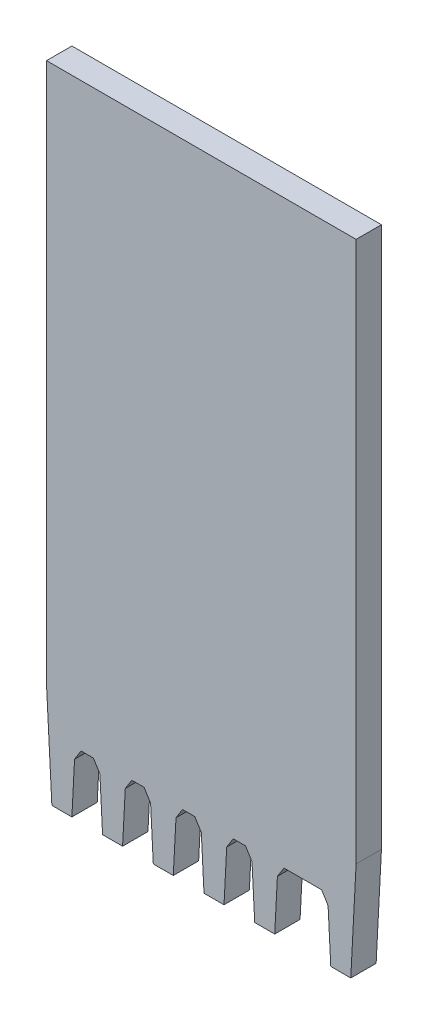
from build123d import *

# Parameters (mm, degrees)
BOSS_EXTRUDE1_DEPTH = 1.5


with BuildPart() as part:
    # Sketch1 → Boss-Extrude1 (new body)
    with BuildSketch(Plane.XY):
        Polygon((0, 6), (0.314446676, 0), (1.497941481, 0), (1.657221927, 3.039251967), (2.042586863, 3.65596478), (2.769801294, 3.65596478), (3.155166229, 3.039251967), (3.314446676, 0), (4.497941481, 0), (4.657221927, 3.039251967), (5.042586863, 3.65596478), (5.769801294, 3.65596478), (6.155166229, 3.039251967), (6.314446676, 0), (7.497941481, 0), (7.657221927, 3.039251967), (8.042586863, 3.65596478), (8.769801294, 3.65596478), (9.155166229, 3.039251967), (9.314446676, 0), (10.497941481, 0), (10.657221927, 3.039251967), (11.042586863, 3.65596478), (11.769801294, 3.65596478), (12.155166229, 3.039251967), (12.314446676, 0), (13.497941481, 0), (13.657221927, 3.039251967), (14.042586863, 3.65596478), (16.269801294, 3.65596478), (16.655166229, 3.039251967), (16.814446676, 0), (17.997941481, 0), (18.312388157, 6), (18.312388157, 38), (0, 38), align=None)
    extrude(amount=BOSS_EXTRUDE1_DEPTH)


solid = part.part
